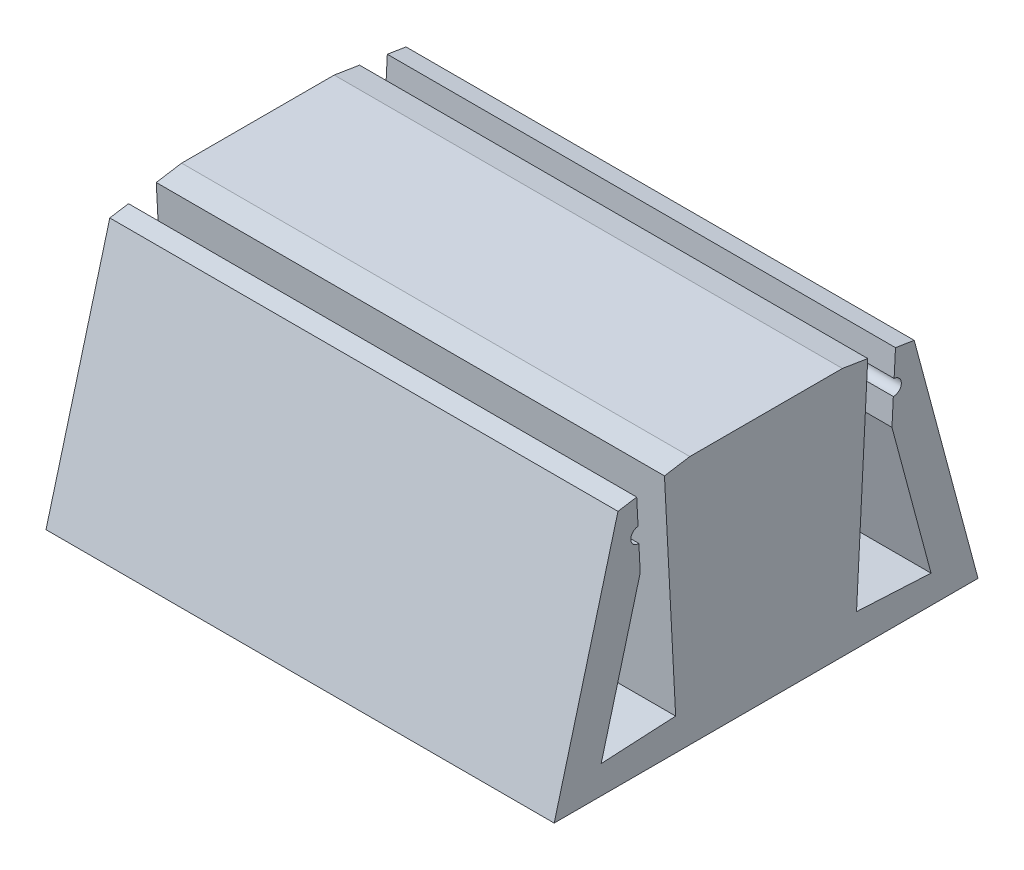
from build123d import *

# Parameters (mm, degrees)
BOSS_EXTRUDE1_DEPTH = 10


with BuildPart() as part:
    # Sketch1 → Boss-Extrude1 (new, symmetric)
    with BuildSketch(Plane(origin=(0, 0, 0), x_dir=(0, 0, -1), z_dir=(1, 0, 0))):
        with BuildLine():
            Line((6.081551938, 6.841542851), (7.61911384, 1.103283712))
            Line((7.61911384, 1.103283712), (4.687365208, 1.256930148))
            Line((4.687365208, 1.256930148), (5.127959845, 9.663976652))
            Line((5.127959845, 9.663976652), (4.1299561, 9.824299843))
            Line((4.1299561, 9.824299843), (-1.874036409, 9.824299843))
            Line((-1.874036409, 9.824299843), (-2.872040155, 9.663976652))
            Line((-2.872040155, 9.663976652), (-2.431445517, 1.256930148))
            Line((-2.431445517, 1.256930148), (-5.36319415, 1.103283712))
            Line((-5.36319415, 1.103283712), (-3.825632248, 6.841542851))
            Line((-3.825632248, 6.841542851), (-3.879292118, 7.86543416))
            ThreePointArc((-3.879292118, 7.86543416), (-4.194581765, 8.149322234), (-3.910693691, 8.464611881))
            Line((-3.910693691, 8.464611881), (-3.964353561, 9.488503191))
            Line((-3.964353561, 9.488503191), (-4.701004321, 9.370164756))
            Line((-4.701004321, 9.370164756), (-7.2117324, 0))
            Line((-7.2117324, 0), (-2.365572599, 0))
            Line((-2.365572599, 0), (4.62149229, 0))
            Line((4.62149229, 0), (9.46765209, 0))
            Line((9.46765209, 0), (6.956924011, 9.370164756))
            Line((6.956924011, 9.370164756), (6.220273251, 9.488503191))
            Line((6.220273251, 9.488503191), (6.166613382, 8.464611881))
            ThreePointArc((6.166613382, 8.464611881), (6.450501455, 8.149322234), (6.135211808, 7.86543416))
            Line((6.135211808, 7.86543416), (6.081551938, 6.841542851))
        make_face()
    extrude(amount=BOSS_EXTRUDE1_DEPTH, both=True)


solid = part.part
